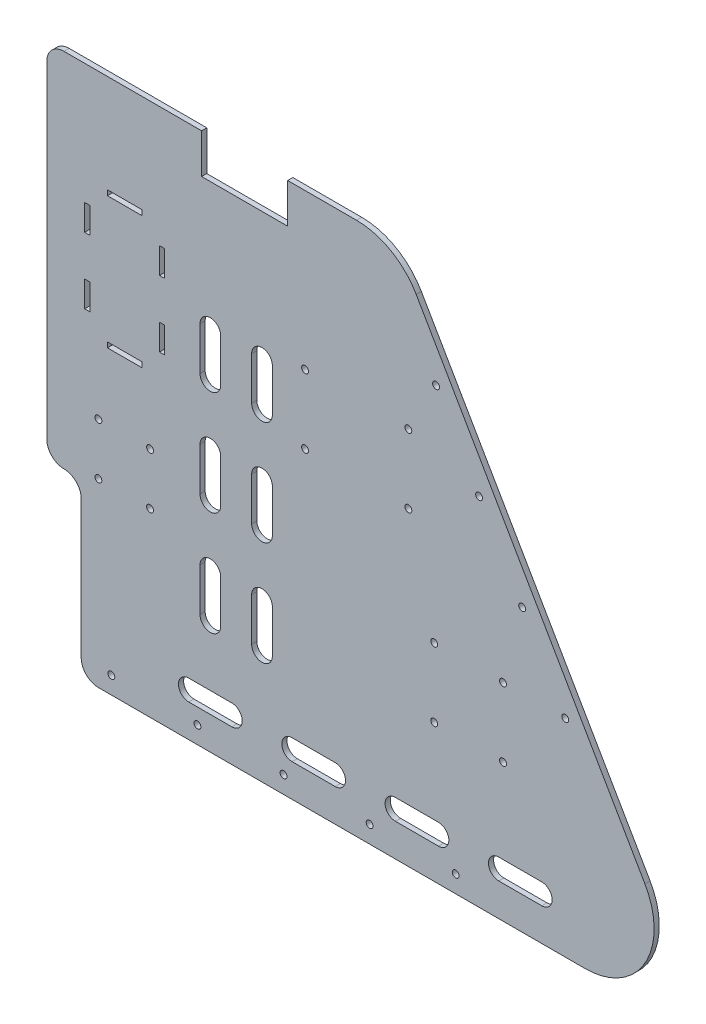
from build123d import *

# Parameters (mm, degrees)
EXTRUDE_1_DEPTH        = 3
SKETCH_2_R             = 2
CUT_EXTRUDE_1_DEPTH    = 10
SKETCH_3_W             = 45
SKETCH_3_H             = 100
CUT_EXTRUDE_2_DEPTH    = 489.651064791
FILLET_1_R             = 10
SKETCH_5_W             = 3
SKETCH_5_H             = 15
SKETCH_5_W_2           = 20
SKETCH_5_H_2           = 3
CUT_EXTRUDE_2593_DEPTH = 10
CUT_EXTRUDE_3695_DEPTH = 10
SKETCH_7_R             = 2
CUT_EXTRUDE_5_DEPTH    = 10


with BuildPart() as part:
    # 草图1 → 凸台-拉伸1 (new body)
    with BuildSketch(Plane.XY):
        with BuildLine():
            Line((0, 66), (0, 0))
            Line((0, 0), (337.717967697, 0))
            ThreePointArc((337.717967697, 0), (372.358983849, 20), (372.358983849, 60))
            Line((372.358983849, 60), (239.568421935, 290))
            ThreePointArc((239.568421935, 290), (224.927405784, 304.641016151), (204.927405784, 310))
            Line((204.927405784, 310), (164.927405784, 310))
            Line((164.927405784, 310), (164.927405784, 287))
            Line((164.927405784, 287), (114.927405784, 287))
            Line((114.927405784, 287), (114.927405784, 310))
            Line((114.927405784, 310), (25, 310))
            Line((25, 310), (25, 66))
            Line((25, 66), (0, 66))
        make_face()
    extrude(amount=EXTRUDE_1_DEPTH)

    # 草图2 → 切除-拉伸1 (cut)
    with BuildSketch(Plane.XY.offset(3)):
        with Locations((262.5, 10)):
            Circle(SKETCH_2_R)
        with Locations((212.5, 10)):
            Circle(SKETCH_2_R)
        with Locations((162.5, 10)):
            Circle(SKETCH_2_R)
        with Locations((112.5, 10)):
            Circle(SKETCH_2_R)
        with Locations((62.5, 10)):
            Circle(SKETCH_2_R)
        with Locations((251.089745962, 250.044481415)):
            Circle(SKETCH_2_R)
        with Locations((276.089745962, 206.743211225)):
            Circle(SKETCH_2_R)
        with Locations((301.089745962, 163.441941036)):
            Circle(SKETCH_2_R)
        with Locations((326.089745962, 120.140670847)):
            Circle(SKETCH_2_R)
    extrude(amount=-CUT_EXTRUDE_1_DEPTH, mode=Mode.SUBTRACT)

    # 草图3 → 切除-拉伸2 (cut, through all)
    with BuildSketch(Plane.XY.offset(3)):
        with Locations((22.5, 50)):
            Rectangle(SKETCH_3_W, SKETCH_3_H)
    extrude(amount=-CUT_EXTRUDE_2_DEPTH, mode=Mode.SUBTRACT)

    # 圆角1
    fillet_1_edges = [part.edges().sort_by_distance(p)[0] for p in [
        (25, 310, 1.5),
        (25, 100, 1.5),
        (45, 100, 1.5),
        (45, 0, 1.5),
    ]]
    fillet(fillet_1_edges, radius=FILLET_1_R - 0.0001)  # a hair under: the kernel refuses the full size

    # 草图5 → Cut-Extrude 2593 (cut)
    with BuildSketch(Plane(origin=(0, 0, 0), x_dir=(-1, 0, 0), z_dir=(0, 0, -1))):
        with Locations((-92, 232.5)):
            Rectangle(SKETCH_5_W, SKETCH_5_H)
        with Locations((-92, 194)):
            Rectangle(SKETCH_5_W, SKETCH_5_H)
        with Locations((-48.5, 194)):
            Rectangle(SKETCH_5_W, SKETCH_5_H)
        with Locations((-48.5, 232.5)):
            Rectangle(SKETCH_5_W, SKETCH_5_H)
        with Locations((-70.25, 251.5)):
            Rectangle(SKETCH_5_W_2, SKETCH_5_H_2)
        with Locations((-70.25, 175)):
            Rectangle(SKETCH_5_W_2, SKETCH_5_H_2)
    extrude(amount=-CUT_EXTRUDE_2593_DEPTH, mode=Mode.SUBTRACT)

    # 草图6 → Cut-Extrude 3695 (cut)
    with BuildSketch(Plane(origin=(0, 0, 0), x_dir=(-1, 0, 0), z_dir=(0, 0, -1))):
        with BuildLine():
            Line((-312.5, 31), (-287.5, 31))
            ThreePointArc((-287.5, 31), (-281.5, 25), (-287.5, 19))
            Line((-287.5, 19), (-312.5, 19))
            ThreePointArc((-312.5, 19), (-318.5, 25), (-312.5, 31))
        make_face()
        with BuildLine():
            Line((-252.5, 19), (-227.5, 19))
            ThreePointArc((-227.5, 19), (-221.5, 25), (-227.5, 31))
            Line((-227.5, 31), (-252.5, 31))
            ThreePointArc((-252.5, 31), (-258.5, 25), (-252.5, 19))
        make_face()
        with BuildLine():
            Line((-192.5, 19), (-167.5, 19))
            ThreePointArc((-167.5, 19), (-161.5, 25), (-167.5, 31))
            Line((-167.5, 31), (-192.5, 31))
            ThreePointArc((-192.5, 31), (-198.5, 25), (-192.5, 19))
        make_face()
        with BuildLine():
            Line((-132.5, 19), (-107.5, 19))
            ThreePointArc((-107.5, 19), (-101.5, 25), (-107.5, 31))
            Line((-107.5, 31), (-132.5, 31))
            ThreePointArc((-132.5, 31), (-138.5, 25), (-132.5, 19))
        make_face()
        with BuildLine():
            Line((-114, 212.5), (-114, 187.5))
            ThreePointArc((-114, 187.5), (-120, 181.5), (-126, 187.5))
            Line((-126, 187.5), (-126, 212.5))
            ThreePointArc((-126, 212.5), (-120, 218.5), (-114, 212.5))
        make_face()
        with BuildLine():
            Line((-144, 212.5), (-144, 187.5))
            ThreePointArc((-144, 187.5), (-150, 181.5), (-156, 187.5))
            Line((-156, 187.5), (-156, 212.5))
            ThreePointArc((-156, 212.5), (-150, 218.5), (-144, 212.5))
        make_face()
        with BuildLine():
            Line((-144, 151.861710405), (-144, 126.861710405))
            ThreePointArc((-144, 126.861710405), (-150, 120.861710405), (-156, 126.861710405))
            Line((-156, 126.861710405), (-156, 151.861710405))
            ThreePointArc((-156, 151.861710405), (-150, 157.861710405), (-144, 151.861710405))
        make_face()
        with BuildLine():
            Line((-144, 91.22342081), (-144, 66.22342081))
            ThreePointArc((-144, 66.22342081), (-150, 60.22342081), (-156, 66.22342081))
            Line((-156, 66.22342081), (-156, 91.22342081))
            ThreePointArc((-156, 91.22342081), (-150, 97.22342081), (-144, 91.22342081))
        make_face()
        with BuildLine():
            Line((-114, 151.861710405), (-114, 126.861710405))
            ThreePointArc((-114, 126.861710405), (-120, 120.861710405), (-126, 126.861710405))
            Line((-126, 126.861710405), (-126, 151.861710405))
            ThreePointArc((-126, 151.861710405), (-120, 157.861710405), (-114, 151.861710405))
        make_face()
        with BuildLine():
            Line((-114, 91.22342081), (-114, 66.22342081))
            ThreePointArc((-114, 66.22342081), (-120, 60.22342081), (-126, 66.22342081))
            Line((-126, 66.22342081), (-126, 91.22342081))
            ThreePointArc((-126, 91.22342081), (-120, 97.22342081), (-114, 91.22342081))
        make_face()
    extrude(amount=-CUT_EXTRUDE_3695_DEPTH, mode=Mode.SUBTRACT)

    # 草图7 → 切除-拉伸5 (cut)
    with BuildSketch(Plane(origin=(0, 0, 0), x_dir=(-1, 0, 0), z_dir=(0, 0, -1))):
        with Locations((-290, 120)):
            Circle(SKETCH_7_R)
        with Locations((-250, 120)):
            Circle(SKETCH_7_R)
        with Locations((-290, 80)):
            Circle(SKETCH_7_R)
        with Locations((-250, 80)):
            Circle(SKETCH_7_R)
        with Locations((-85, 135)):
            Circle(SKETCH_7_R)
        with Locations((-55, 135)):
            Circle(SKETCH_7_R)
        with Locations(Location((-55, 105, 0), (0, 0, 180))):
            Circle(SKETCH_7_R)
        with Locations(Location((-85, 105, 0), (0, 0, 180))):
            Circle(SKETCH_7_R)
        with Locations((-235, 220)):
            Circle(SKETCH_7_R)
        with Locations((-235, 180)):
            Circle(SKETCH_7_R)
        with Locations(Location((-175, 180, 0), (0, 0, 180))):
            Circle(SKETCH_7_R)
        with Locations(Location((-175, 220, 0), (0, 0, 180))):
            Circle(SKETCH_7_R)
    extrude(amount=-CUT_EXTRUDE_5_DEPTH, mode=Mode.SUBTRACT)


solid = part.part
